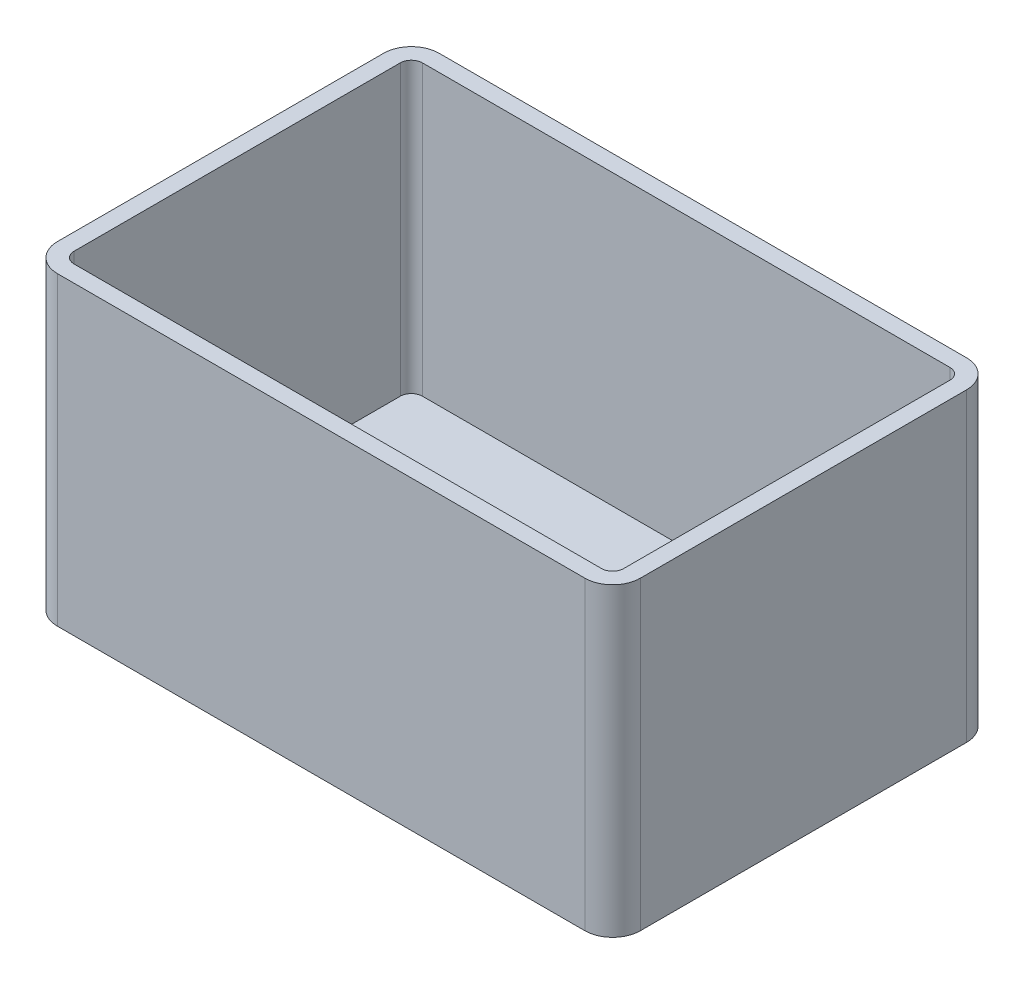
from build123d import *

# Parameters (mm, degrees)
BOSS_EXTRUDE1_DEPTH                     = 55
SHELL1_T                                = -3
CUT_EXTRUDE1_DEPTH                      = 2
BATTERY_CONNECTOR_SKETCH_3_R            = 2.15
CUT_EXTRUDE2_DEPTH                      = 3
BATTERY_CONNECTOR_SKETCH_4_R            = 2.15
CUT_EXTRUDE3_DEPTH                      = 3
BOSS_EXTRUDE6_START                     = 12.75
BOSS_EXTRUDE6_DEPTH                     = 12.75
CONNECTOR_SIDE_MOUNT_SKETCH_R           = 1.55
CONNECTOR_SIDE_MOUNT_SKETCH_R_2         = 1.505
CONNECTOR_MOUNT_PINS_SOCKETS_DEPTH      = 2.4
CONNECTOR_MOUNT_PINS_SOCKETS_SKETCH_3_W = 24.3
CONNECTOR_MOUNT_PINS_SOCKETS_SKETCH_3_H = 1.2
BOSS_EXTRUDE7_DEPTH                     = 0.7


with BuildPart() as part:
    # Sketch2 → Boss-Extrude1 (new body)
    with BuildSketch(Plane(origin=(0, 0, 0), x_dir=(1, 0, 0), z_dir=(0, 1, 0))):
        with BuildLine():
            Line((47.5, -34.375), (-47.5, -34.375))
            ThreePointArc((-47.5, -34.375), (-51.035533906, -32.910533906), (-52.5, -29.375))
            Line((-52.5, -29.375), (-52.5, 29.375))
            ThreePointArc((-52.5, 29.375), (-51.035533906, 32.910533906), (-47.5, 34.375))
            Line((-47.5, 34.375), (47.5, 34.375))
            ThreePointArc((47.5, 34.375), (51.035533906, 32.910533906), (52.5, 29.375))
            Line((52.5, 29.375), (52.5, -29.375))
            ThreePointArc((52.5, -29.375), (51.035533906, -32.910533906), (47.5, -34.375))
        make_face()
    extrude(amount=BOSS_EXTRUDE1_DEPTH)

    # Shell1
    shell1_openings = [part.faces().sort_by_distance(p)[0] for p in [
        (0, 55, 0),
    ]]
    offset(amount=SHELL1_T, openings=shell1_openings, kind=Kind.INTERSECTION)

    # battery_connector_sketch → Cut-Extrude1 (cut)
    with BuildSketch(Plane(origin=(0, 3, 0), x_dir=(1, 0, 0), z_dir=(0, 1, 0))):
        with BuildLine():
            Line((-48.255414742, -4.831437415), (-48.255414742, -29.131437415))
            ThreePointArc((-48.255414742, -29.131437415), (-47.669628305, -30.545650977), (-46.255414742, -31.131437415))
            Line((-46.255414742, -31.131437415), (-40.255414742, -31.131437415))
            ThreePointArc((-40.255414742, -31.131437415), (-38.84120118, -30.545650977), (-38.255414742, -29.131437415))
            Line((-38.255414742, -29.131437415), (-38.255414742, -21.901437415))
            Line((-38.255414742, -21.901437415), (-39.505414742, -20.561437415))
            Line((-39.505414742, -20.561437415), (-39.505414742, -13.401437415))
            Line((-39.505414742, -13.401437415), (-38.255414742, -12.061437415))
            Line((-38.255414742, -12.061437415), (-38.255414742, -4.831437415))
            ThreePointArc((-38.255414742, -4.831437415), (-38.84120118, -3.417223852), (-40.255414742, -2.831437415))
            Line((-40.255414742, -2.831437415), (-46.255414742, -2.831437415))
            ThreePointArc((-46.255414742, -2.831437415), (-47.669628305, -3.417223852), (-48.255414742, -4.831437415))
        make_face()
    extrude(amount=-CUT_EXTRUDE1_DEPTH, mode=Mode.SUBTRACT)

    # battery_connector_sketch<3> → Cut-Extrude2 (cut)
    with BuildSketch(Plane(origin=(0, 3, 0), x_dir=(1, 0, 0), z_dir=(0, 1, 0))):
        with Locations((-43.255414742, -6.881437415)):
            Circle(BATTERY_CONNECTOR_SKETCH_3_R)
    extrude(amount=-CUT_EXTRUDE2_DEPTH, mode=Mode.SUBTRACT)

    # battery_connector_sketch<4> → Cut-Extrude3 (cut)
    with BuildSketch(Plane(origin=(0, 3, 0), x_dir=(1, 0, 0), z_dir=(0, 1, 0))):
        with Locations((-43.255414742, -24.831437415)):
            Circle(BATTERY_CONNECTOR_SKETCH_4_R)
    extrude(amount=-CUT_EXTRUDE3_DEPTH, mode=Mode.SUBTRACT)

    # Sketch25 → Boss-Extrude6 (add)
    with BuildSketch(Plane(origin=(0, 3, 0), x_dir=(1, 0, 0), z_dir=(0, 1, 0)).offset(BOSS_EXTRUDE6_START)):
        with BuildLine():
            Line((-46.255414742, -31.131437415), (-48.456518483, -31.131437415))
            ThreePointArc((-48.456518483, -31.131437415), (-49.21945296, -30.396509431), (-49.5, -29.375))
            Line((-49.5, -29.375), (-49.5, -2.831437415))
            Line((-49.5, -2.831437415), (-46.255414742, -2.831437415))
            ThreePointArc((-46.255414742, -2.831437415), (-47.669628305, -3.417223852), (-48.255414742, -4.831437415))
            Line((-48.255414742, -4.831437415), (-48.255414742, -29.131437415))
            ThreePointArc((-48.255414742, -29.131437415), (-47.669628305, -30.545650977), (-46.255414742, -31.131437415))
        make_face()
    extrude(amount=-BOSS_EXTRUDE6_DEPTH)

    # connector_side_mount_sketch → connector_mount_pins_sockets (cut)
    with BuildSketch(Plane(origin=(-48.255414742, 0, 0), x_dir=(0, 0, -1), z_dir=(1, 0, 0))):
        with Locations((-9.891437415, 11.25)):
            Circle(CONNECTOR_SIDE_MOUNT_SKETCH_R)
        with Locations((-24.071437415, 11.25)):
            Circle(CONNECTOR_SIDE_MOUNT_SKETCH_R_2)
    extrude(amount=-CONNECTOR_MOUNT_PINS_SOCKETS_DEPTH, mode=Mode.SUBTRACT)

    # connector_mount_pins_sockets_sketch<3> → Boss-Extrude7 (add)
    with BuildSketch(Plane(origin=(-48.255414742, 0, 0), x_dir=(0, 0, -1), z_dir=(1, 0, 0))):
        with Locations((-16.981437415, 6.6)):
            Rectangle(CONNECTOR_MOUNT_PINS_SOCKETS_SKETCH_3_W, CONNECTOR_MOUNT_PINS_SOCKETS_SKETCH_3_H)
    extrude(amount=BOSS_EXTRUDE7_DEPTH)


solid = part.part
